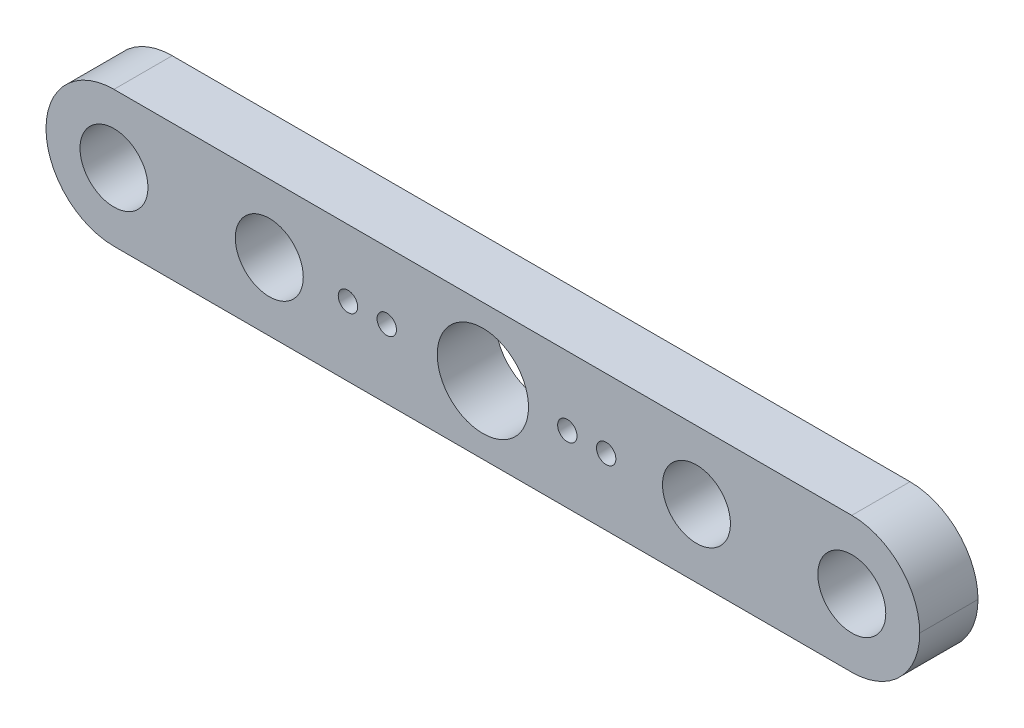
from build123d import *

# Parameters (mm, degrees)
SKETCH1_W                = 68.327661803
SKETCH1_H                = 52.686389824
BOSS_EXTRUDE1_DEPTH      = 3
CUT_EXTRUDE1_DEPTH       = 100
SKETCH4_W                = 3
SKETCH4_H                = 16.961263462
BOSS_EXTRUDE2_DEPTH      = 4
SKETCH5_W                = 3
SKETCH5_H                = 16.961263462
BOSS_EXTRUDE3_DEPTH      = 39.5
SKETCH6_W                = 3
SKETCH6_H                = 16.961263462
BOSS_EXTRUDE4_DEPTH      = 35.754290268
FILLET1_R                = 7.5
FILLET2_R                = 7.5
FILLET3_R                = 7.5
FILLET4_R                = 7.5
SKETCH9_R                = 0.5
CUT_EXTRUDE5_DEPTH       = 14
SKETCH7_R                = 0.5
CUT_EXTRUDE6_DEPTH       = 14
SKETCH10_R               = 2.35
CUT_EXTRUDE7_DEPTH       = 10
SKETCH11_R               = 2.35
CUT_EXTRUDE8_DEPTH       = 10
SKETCH12_R               = 1.5
CUT_EXTRUDE9_DEPTH       = 10
CUT_EXTRUDE_4_DEPTH      = 63.27060323
CUT_EXTRUDE_4_DEPTH_BACK = 63.27060323
SKETCH_2_W               = 38.540786773
SKETCH_2_H               = 30.686503212
SKETCH_1_W               = 58.401406077
SKETCH_1_H               = 28.148942287
SKETCH_1_R               = 0.5
SKETCH_1_W_2             = 30
SKETCH_1_H_2             = 7
SKETCH_1_R_2             = 1.75
CUT_EXTRUDE_7_DEPTH      = 51.962343493
SKETCH_3_W               = 7.5
SKETCH_3_H               = 7
SKETCH_3_R               = 1.75
EXTRUDE_1_DEPTH          = 3
FILLET_2_R               = 3.5


with BuildPart() as part:
    # Sketch1 → Boss-Extrude1 (new body)
    with BuildSketch(Plane.XY):
        with Locations((-34.163830901, 26.343194912)):
            Rectangle(SKETCH1_W, SKETCH1_H)
    extrude(amount=BOSS_EXTRUDE1_DEPTH)

    # Sketch2 → Cut-Extrude1 (cut)
    with BuildSketch(Plane(origin=(0, 0, 0), x_dir=(-1, 0, 0), z_dir=(0, 0, -1))):
        Polygon((34.754290268, 32.233658713), (0, 32.233658713), (0, 52.686389824), (34.754290268, 52.686389824), (68.327661803, 52.686389824), (68.327661803, 0), (34.754290268, 0), (0, 0), (0, 15.272395251), (34.754290268, 15.272395251), align=None)
    extrude(amount=-CUT_EXTRUDE1_DEPTH, mode=Mode.SUBTRACT)

    # Sketch4 → Boss-Extrude2 (add)
    with BuildSketch(Plane.ZY.offset(34.754290268)):
        with Locations((1.5, 23.753026982)):
            Rectangle(SKETCH4_W, SKETCH4_H)
    extrude(amount=BOSS_EXTRUDE2_DEPTH)

    # Sketch5 → Boss-Extrude3 (add)
    with BuildSketch(Plane(origin=(0, 0, 0), x_dir=(-1, 0, 0), z_dir=(0, 0, -1))):
        with Locations((37.254290268, 23.753026982)):
            Rectangle(SKETCH5_W, SKETCH5_H)
    extrude(amount=BOSS_EXTRUDE3_DEPTH)

    # Sketch6 → Boss-Extrude4 (add)
    with BuildSketch(Plane(origin=(-35.754290268, 0, 0), x_dir=(0, 0, -1), z_dir=(1, 0, 0))):
        with Locations((38, 23.753026982)):
            Rectangle(SKETCH6_W, SKETCH6_H)
    extrude(amount=BOSS_EXTRUDE4_DEPTH)

    # Fillet1
    fillet1_edges = [part.edges().sort_by_distance(p)[0] for p in [
        (0, 15.272395251, 1.5),
    ]]
    fillet(fillet1_edges, radius=FILLET1_R)

    # Fillet2
    fillet2_edges = [part.edges().sort_by_distance(p)[0] for p in [
        (0, 32.233658713, 1.5),
    ]]
    fillet(fillet2_edges, radius=FILLET2_R)

    # Fillet3
    fillet3_edges = [part.edges().sort_by_distance(p)[0] for p in [
        (0, 32.233658713, -38),
    ]]
    fillet(fillet3_edges, radius=FILLET3_R)

    # Fillet4
    fillet4_edges = [part.edges().sort_by_distance(p)[0] for p in [
        (0, 15.272395251, -38),
    ]]
    fillet(fillet4_edges, radius=FILLET4_R)

    # Sketch9 → Cut-Extrude5 (cut)
    with BuildSketch(Plane.ZY.offset(38.754290268)):
        with Locations((-13.849226824, 24.283657668)):
            Circle(SKETCH9_R)
        with Locations((-11.849226824, 24.283657668)):
            Circle(SKETCH9_R)
        with Locations((-18.799226824, 19.683657668)):
            Circle(SKETCH9_R)
        with Locations((-18.799226824, 17.683657668)):
            Circle(SKETCH9_R)
        with Locations((-23.149226824, 24.283657668)):
            Circle(SKETCH9_R)
        with Locations((-25.149226824, 24.283657668)):
            Circle(SKETCH9_R)
        with Locations((-18.799226824, 30.633657668)):
            Circle(SKETCH9_R)
        with Locations((-18.799226824, 28.633657668)):
            Circle(SKETCH9_R)
    extrude(amount=-CUT_EXTRUDE5_DEPTH, mode=Mode.SUBTRACT)

    # Sketch7 → Cut-Extrude6 (cut)
    with BuildSketch(Plane(origin=(0, 0, 0), x_dir=(-1, 0, 0), z_dir=(0, 0, -1))):
        with Locations((15.785473329, 30.515840692)):
            Circle(SKETCH7_R)
        with Locations((15.805568543, 28.515941649)):
            Circle(SKETCH7_R)
        with Locations((20.799025765, 24.215896885)):
            Circle(SKETCH7_R)
        with Locations((22.798924808, 24.235992099)):
            Circle(SKETCH7_R)
        with Locations((11.499495215, 24.12245414)):
            Circle(SKETCH7_R)
        with Locations((9.499596172, 24.102358926)):
            Circle(SKETCH7_R)
        with Locations((15.895494626, 19.566393431)):
            Circle(SKETCH7_R)
        with Locations((15.91558984, 17.566494388)):
            Circle(SKETCH7_R)
    extrude(amount=-CUT_EXTRUDE6_DEPTH, mode=Mode.SUBTRACT)

    # Sketch10 → Cut-Extrude7 (cut)
    with BuildSketch(Plane.ZY.offset(38.754290268)):
        with Locations((-18.799226824, 24.283657668)):
            Circle(SKETCH10_R)
    extrude(amount=-CUT_EXTRUDE7_DEPTH, mode=Mode.SUBTRACT)

    # Sketch11 → Cut-Extrude8 (cut)
    with BuildSketch(Plane(origin=(0, 0, 0), x_dir=(-1, 0, 0), z_dir=(0, 0, -1))):
        with Locations((15.849275634, 24.16616123)):
            Circle(SKETCH11_R)
    extrude(amount=-CUT_EXTRUDE8_DEPTH, mode=Mode.SUBTRACT)

    # Sketch12 → Cut-Extrude9 (cut)
    with BuildSketch(Plane.XY.offset(-36.5)):
        with Locations((-15.849275634, 24.16616123)):
            Circle(SKETCH12_R)
    extrude(amount=-CUT_EXTRUDE9_DEPTH, mode=Mode.SUBTRACT)

    # 草圖2 → 除料-伸長4 (cut, two sides: drawn at the far end of the back side and taken through both)
    with BuildSketch(Plane(origin=(-35.754290268, 0, 0), x_dir=(0, 0, -1), z_dir=(1, 0, 0)).offset(-CUT_EXTRUDE_4_DEPTH_BACK)):
        with Locations((23.770839113, 24.432880731)):
            Rectangle(SKETCH_2_W, SKETCH_2_H)
    extrude(amount=CUT_EXTRUDE_4_DEPTH + CUT_EXTRUDE_4_DEPTH_BACK, mode=Mode.SUBTRACT)

    # 草圖1 → 除料-伸長7 (cut, through all)
    # profile 1 of 4: a face of its own
    with BuildSketch(Plane.XY.offset(3)):
        with Locations((-17.675205009, 24.250222974)):
            Rectangle(SKETCH_1_W, SKETCH_1_H)
        with BuildLine():
            Line((0, 22.772395251), (0, 24.733658713))
            ThreePointArc((0, 24.733658713), (-2.196699141, 30.036959572), (-7.5, 32.233658713))
            Line((-7.5, 32.233658713), (-38.754290268, 32.233658713))
            Line((-38.754290268, 32.233658713), (-38.754290268, 15.272395251))
            Line((-38.754290268, 15.272395251), (-7.5, 15.272395251))
            ThreePointArc((-7.5, 15.272395251), (-2.196699141, 17.469094393), (0, 22.772395251))
        make_face(mode=Mode.SUBTRACT)
    # profile 2 of 4: a face of its own
    with BuildSketch(Plane.XY.offset(3)):
        with BuildLine():
            ThreePointArc((-7.5, 15.272395251), (-2.196699141, 17.469094393), (0, 22.772395251))
            Line((0, 22.772395251), (0, 24.733658713))
            ThreePointArc((0, 24.733658713), (-2.196699141, 30.036959572), (-7.5, 32.233658713))
            Line((-7.5, 32.233658713), (-38.754290268, 32.233658713))
            Line((-38.754290268, 32.233658713), (-38.754290268, 15.272395251))
            Line((-38.754290268, 15.272395251), (-7.5, 15.272395251))
        make_face()
        with Locations((-15.91558984, 17.566494388)):
            Circle(SKETCH_1_R, mode=Mode.SUBTRACT)
        with Locations((-15.805568543, 28.515941649)):
            Circle(SKETCH_1_R, mode=Mode.SUBTRACT)
        with Locations((-15.895494626, 19.566393431)):
            Circle(SKETCH_1_R, mode=Mode.SUBTRACT)
        with Locations((-15.785473329, 30.515840692)):
            Circle(SKETCH_1_R, mode=Mode.SUBTRACT)
        with Locations((-15.849275634, 24.16616123)):
            Rectangle(SKETCH_1_W_2, SKETCH_1_H_2, mode=Mode.SUBTRACT)
    # profile 3 of 4: a face of its own
    with BuildSketch(Plane.XY.offset(3)):
        with Locations((-4.849275634, 24.16616123)):
            Circle(SKETCH_1_R_2)
    # profile 4 of 4: a face of its own
    with BuildSketch(Plane.XY.offset(3)):
        with Locations((-26.849275634, 24.16616123)):
            Circle(SKETCH_1_R_2)
    extrude(amount=-CUT_EXTRUDE_7_DEPTH, mode=Mode.SUBTRACT)

    # 草圖3 → 填料-伸長1 (add, through all)
    # profile 1 of 2: a face of its own
    with BuildSketch(Plane.XY.offset(3)):
        with Locations((-34.599275634, 24.16616123)):
            Rectangle(SKETCH_3_W, SKETCH_3_H)
        with Locations((-34.849275634, 24.16616123)):
            Circle(SKETCH_3_R, mode=Mode.SUBTRACT)
    # profile 2 of 2: a face of its own
    with BuildSketch(Plane.XY.offset(3)):
        with Locations((2.900724366, 24.16616123)):
            Rectangle(SKETCH_3_W, SKETCH_3_H)
        with Locations((3.150724366, 24.16616123)):
            Circle(SKETCH_3_R, mode=Mode.SUBTRACT)
    extrude(amount=-EXTRUDE_1_DEPTH)

    # 圓角2
    fillet_2_edges = [part.edges().sort_by_distance(p)[0] for p in [
        (6.650724366, 20.66616123, 1.5),
        (6.650724366, 27.66616123, 1.5),
        (-38.349275634, 20.66616123, 1.5),
        (-38.349275634, 27.66616123, 1.5),
    ]]
    fillet(fillet_2_edges, radius=FILLET_2_R - 0.0001)  # a hair under: the kernel refuses the full size


solid = part.part
